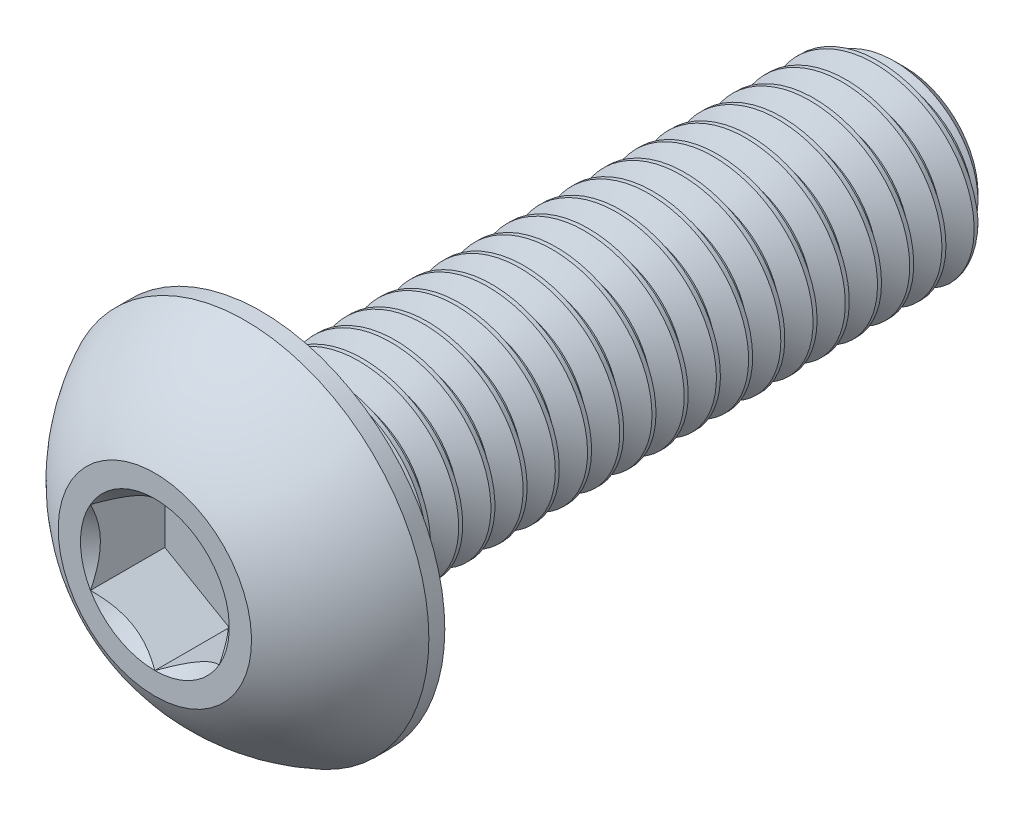
from build123d import *

# Parameters (mm, degrees)
SKETCH1_W          = 10
SKETCH1_H          = 1.5
CHAMFER1_SIZE      = 0.375
CUT_SWEEP1_PITCH   = 0.5
CUT_EXTRUDE2_DEPTH = 1.155


with BuildPart() as part:
    # Sketch1 → Revolve1 (revolve)
    with BuildSketch(Plane(origin=(0, 0, 0), x_dir=(0, 0, -1), z_dir=(1, 0, 0))):
        with Locations((6.65, 0.75)):
            Rectangle(SKETCH1_W, SKETCH1_H)
    revolve(axis=Axis((0, 0, -11.65), (0, 0, 1)))

    # Chamfer1
    chamfer1_edges = [part.edges().sort_by_distance(p)[0] for p in [
        (0, -1.5, -11.65),
    ]]
    chamfer(chamfer1_edges, length=CHAMFER1_SIZE)

    # Cut-Sweep1: the profile of Sketch2 profile screwed along a right-hand helix of 21 turns, 6 arcs to a turn; built about Z, then put on its axis
    cut_sweep1_z = Axis((0, 0, 0), (0, 0, 1))
    cut_sweep1_corners = [(1.5003, 0, 0.000173205), (1.5003, 0, -0.437673205), (1.175240474, 0, -0.25), (1.175240474, 0, -0.1875)]
    with BuildLine(mode=Mode.PRIVATE) as cut_sweep1_profile:
        Line(cut_sweep1_corners[0], cut_sweep1_corners[1])
        Line(cut_sweep1_corners[1], cut_sweep1_corners[2])
        Line(cut_sweep1_corners[2], cut_sweep1_corners[3])
        Line(cut_sweep1_corners[3], cut_sweep1_corners[0])
    cut_sweep1_cap = Face(cut_sweep1_profile.wire())
    cut_sweep1_turn_angles = [0, 30, 60, 90, 120, 150, 180, 210, 240, 270, 300, 330, 360]
    cut_sweep1_turn_weights = [1, 0.8660254037844387, 1, 0.8660254037844387, 1, 0.8660254037844387, 1, 0.8660254037844387, 1, 0.8660254037844387, 1, 0.8660254037844387, 1]
    cut_sweep1_turn_rails = [Edge.make_bspline([Vector(p[0], p[1], 0).rotate(cut_sweep1_z, cut_sweep1_turn_angles[k]) / cut_sweep1_turn_weights[k] + Vector(0, 0, p[2] + CUT_SWEEP1_PITCH * cut_sweep1_turn_angles[k] / 360) for k in range(13)], [0, 0, 0, 1, 1, 2, 2, 3, 3, 4, 4, 5, 5, 6, 6, 6], 2, cut_sweep1_turn_weights) for p in cut_sweep1_corners]
    cut_sweep1_turn_sides = [Face.make_surface_from_curves(cut_sweep1_turn_rails[p[0]], cut_sweep1_turn_rails[p[1]]) for p in [(0, 1), (1, 2), (2, 3), (3, 0)]]
    cut_sweep1 = Plane(origin=(0, 0, -11.65), x_dir=(0, 1, 0), z_dir=(0, 0, 1)) * Solid(Shell([*[p.moved(Location((0, 0, CUT_SWEEP1_PITCH * i))) for i in range(21) for p in cut_sweep1_turn_sides], cut_sweep1_cap, cut_sweep1_cap.rotate(cut_sweep1_z, 7560).moved(Location((0, 0, CUT_SWEEP1_PITCH * 7560 / 360)))]))
    add(cut_sweep1, mode=Mode.SUBTRACT)

    # Sketch7 → Revolve2 (revolve)
    with BuildSketch(Plane(origin=(0, 0, 0), x_dir=(0, 0, -1), z_dir=(1, 0, 0)), mode=Mode.PRIVATE) as revolve2_sk:
        with BuildLine():
            Line((1.4025, 2.85), (1.65, 2.85))
            Line((1.65, 2.85), (1.65, 0))
            Line((1.65, 0), (0, 0))
            Line((0, 0), (0, 1.5))
            ThreePointArc((0, 1.5), (0.59512511, 2.285251969), (1.4025, 2.85))
        make_face()
    revolve(revolve2_sk.sketch.rotate(Axis((0, 0, 0), (0, 0, -1)), 189.336081704), axis=Axis((0, 0, 0), (0, 0, -1)))

    # Sketch5 → Cut-Extrude2 (cut)
    with BuildSketch(Plane.XY):
        Polygon((1, -0.577350269), (1, 0.577350269), (0, 1.154700538), (-1, 0.577350269), (-1, -0.577350269), (0, -1.154700538), align=None)
    extrude(amount=-CUT_EXTRUDE2_DEPTH, mode=Mode.SUBTRACT)

    # Cut-Extrude3 cone 1 section (through the dimple's axis) → Cut-Extrude3 (revolve, cut)
    with BuildSketch(Plane(origin=(0, 0, 0), x_dir=(0, -1, 0), z_dir=(1, 0, 0))):
        Polygon((0, 0), (1.154700538, 0), (0, 1.154700538), align=None)
    revolve(axis=Axis((0, 0, 0), (0, 0, -1)), mode=Mode.SUBTRACT)


solid = part.part
